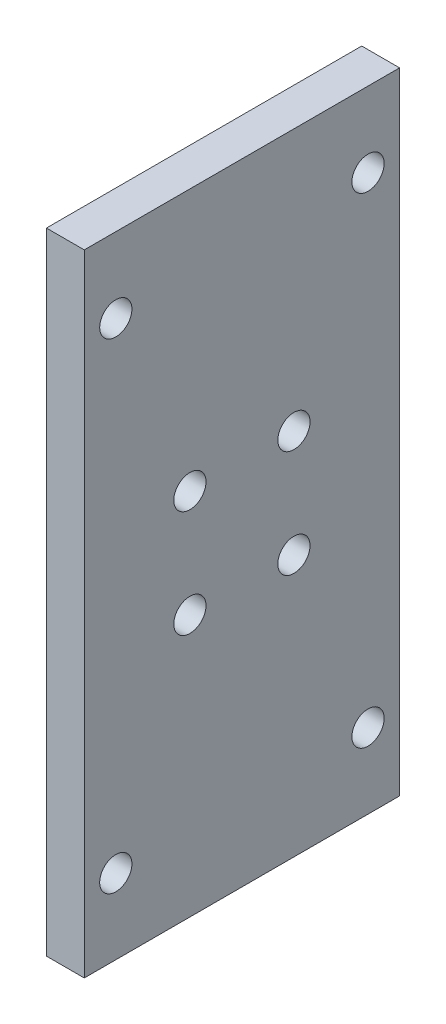
from build123d import *

# Parameters (mm, degrees)
SKETCH1_W           = 100
SKETCH1_H           = 50
SKETCH1_R           = 2.555
BOSS_EXTRUDE1_DEPTH = 6


with BuildPart() as part:
    # Sketch1 → Boss-Extrude1 (new body)
    with BuildSketch(Plane.YZ):
        Rectangle(SKETCH1_W, SKETCH1_H)
        with Locations((-8.5, 8.25)):
            Circle(SKETCH1_R, mode=Mode.SUBTRACT)
        with Locations((-8.5, -8.25)):
            Circle(SKETCH1_R, mode=Mode.SUBTRACT)
        with Locations((8.5, -8.25)):
            Circle(SKETCH1_R, mode=Mode.SUBTRACT)
        with Locations((8.5, 8.25)):
            Circle(SKETCH1_R, mode=Mode.SUBTRACT)
        with Locations((-38.1, 20)):
            Circle(SKETCH1_R, mode=Mode.SUBTRACT)
        with Locations((-38.1, -20)):
            Circle(SKETCH1_R, mode=Mode.SUBTRACT)
        with Locations((38.1, 20)):
            Circle(SKETCH1_R, mode=Mode.SUBTRACT)
        with Locations((38.1, -20)):
            Circle(SKETCH1_R, mode=Mode.SUBTRACT)
    extrude(amount=BOSS_EXTRUDE1_DEPTH)


solid = part.part
